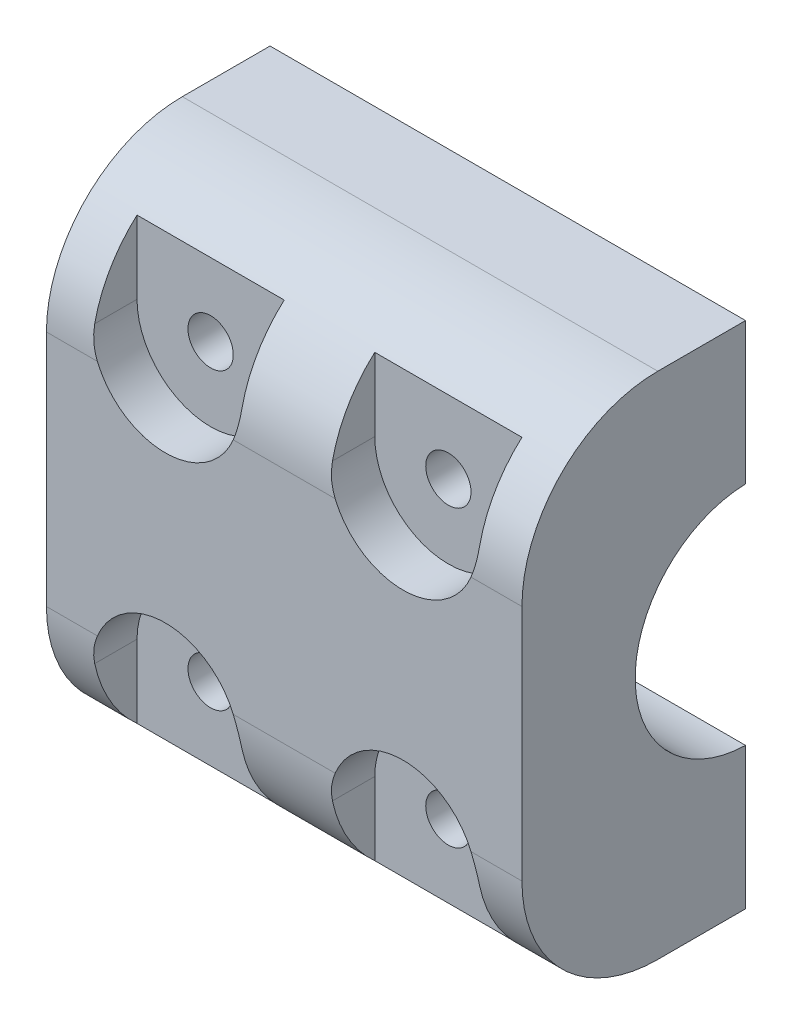
from build123d import *

# Parameters (mm, degrees)
BOSS_EXTRUDE1_DEPTH = 42
SKETCH2_R           = 2
CUT_EXTRUDE2_DEPTH  = 52.578217301
CUT_EXTRUDE3_DEPTH  = 4


with BuildPart() as part:
    # Sketch1 → Boss-Extrude1 (new body)
    with BuildSketch(Plane(origin=(0, 0, 0), x_dir=(0, 0, -1), z_dir=(1, 0, 0))):
        with BuildLine():
            Line((-0.25, 9.996874512), (-0.25, 22.5))
            Line((-0.25, 22.5), (-3, 22.5))
            Line((-3, 22.5), (-8, 22.5))
            ThreePointArc((-8, 22.5), (-16.485281374, 18.985281374), (-20, 10.5))
            Line((-20, 10.5), (-20, -10.5))
            ThreePointArc((-20, -10.5), (-16.485281374, -18.985281374), (-8, -22.5))
            Line((-8, -22.5), (-3, -22.5))
            Line((-3, -22.5), (-0.25, -22.5))
            Line((-0.25, -22.5), (-0.25, -9.996874512))
            ThreePointArc((-0.25, -9.996874512), (-10, 0), (-0.25, 9.996874512))
        make_face()
    extrude(amount=-BOSS_EXTRUDE1_DEPTH)

    # Sketch2 → Cut-Extrude2 (cut, through all)
    with BuildSketch(Plane.XY.offset(0.25)):
        with Locations((-31.5, 13)):
            Circle(SKETCH2_R)
        with Locations((-10.5, 13)):
            Circle(SKETCH2_R)
        with Locations((-10.5, -13)):
            Circle(SKETCH2_R)
        with Locations((-31.5, -13)):
            Circle(SKETCH2_R)
    extrude(amount=CUT_EXTRUDE2_DEPTH, mode=Mode.SUBTRACT)

    # Sketch3 → Cut-Extrude3 (cut)
    with BuildSketch(Plane.XY.offset(20)):
        with BuildLine():
            Line((-38, 13), (-38, 19.5))
            Line((-38, 19.5), (-25, 19.5))
            Line((-25, 19.5), (-25, 13))
            ThreePointArc((-25, 13), (-31.5, 6.5), (-38, 13))
        make_face()
        with BuildLine():
            Line((-17, 13), (-17, 19.5))
            Line((-17, 19.5), (-4, 19.5))
            Line((-4, 19.5), (-4, 13))
            ThreePointArc((-4, 13), (-10.5, 6.5), (-17, 13))
        make_face()
        with BuildLine():
            Line((-4, -19.5), (-4, -13))
            ThreePointArc((-4, -13), (-10.5, -6.5), (-17, -13))
            Line((-17, -13), (-17, -19.5))
            Line((-17, -19.5), (-4, -19.5))
        make_face()
        with BuildLine():
            Line((-25, -19.5), (-25, -13))
            ThreePointArc((-25, -13), (-31.5, -6.5), (-38, -13))
            Line((-38, -13), (-38, -19.5))
            Line((-38, -19.5), (-25, -19.5))
        make_face()
    extrude(amount=-CUT_EXTRUDE3_DEPTH, mode=Mode.SUBTRACT)


solid = part.part
